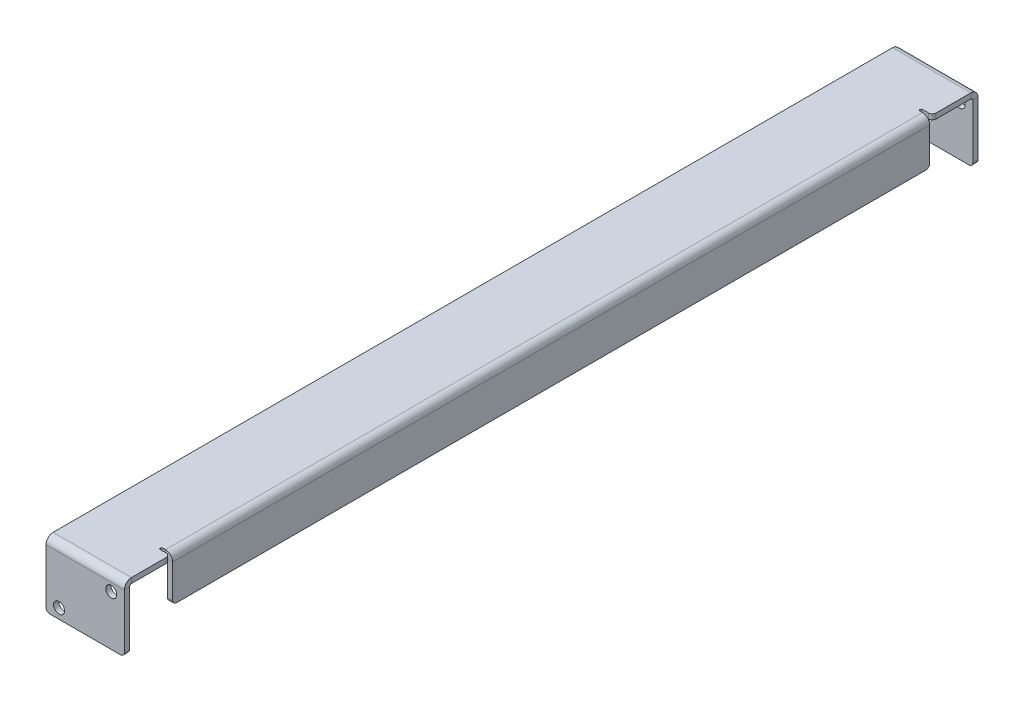
from build123d import *

# Parameters (mm, degrees)
SKETCH1_W                    = 327
SKETCH1_H                    = 2
BASE_FLANGE1_DEPTH           = 15
EDGE_FLANGE1_STRIP_W         = 9.4732
EDGE_FLANGE1_STRIP_H         = 2
EDGE_FLANGE1_STRIP_CUT_DEPTH = 30
EDGE_FLANGE1_DEPTH           = 30
CUT_EXTRUDE1_REACH           = 329.582
SKETCH9_R                    = 2.1
EDGE_FLANGE2_START           = 9.7634
EDGE_FLANGE2_DEPTH           = 3.2366
EDGE_FLANGE2_START_2         = -4.5
EDGE_FLANGE2_2_OUTLINE_W     = 2
EDGE_FLANGE2_2_OUTLINE_H     = 290
EDGE_FLANGE2_2_DEPTH         = 14.2634
EDGE_FLANGE2_START_3         = -145
EDGE_FLANGE2_3_DEPTH         = 290
EDGE_FLANGE2_4_DEPTH         = 290
FILLET1_R                    = 1.5


with BuildPart() as part:
    # Base-Flange1: sheet metal written as solids
    # Sketch1 → Base-Flange1 (new, symmetric)
    with BuildSketch(Plane(origin=(0, 0, 0), x_dir=(0, 0, -1), z_dir=(1, 0, 0))):
        with Locations((0, 11.5)):
            Rectangle(SKETCH1_W, SKETCH1_H)
    extrude(amount=BASE_FLANGE1_DEPTH, both=True)

    # Edge-Flange1: sheet metal written as solids
    # Edge-Flange1 strip (on a plane across the edge) → Edge-Flange1 strip cut (cut)
    with BuildSketch(Plane(origin=(15, 10.5, 163.5), x_dir=(0, 0, -1), z_dir=(-1, 0, 0))):
        with Locations((-2, -1)):
            Rectangle(EDGE_FLANGE1_STRIP_W, EDGE_FLANGE1_STRIP_H)
    edge_flange1_strip_cut = extrude(amount=EDGE_FLANGE1_STRIP_CUT_DEPTH, mode=Mode.SUBTRACT)

    # Edge-Flange1 section (on a plane across the edge) → Edge-Flange1 (add)
    with BuildSketch(Plane(origin=(15, 10.5, 163.5), x_dir=(0, 0, -1), z_dir=(-1, 0, 0))):
        with BuildLine():
            Line((0, 0.7366), (0, 23))
            Line((0, 23), (2, 23))
            Line((2, 23), (2, 0.7366))
            ThreePointArc((2, 0.7366), (2.215745145, 0.215745145), (2.7366, 0))
            Line((2.7366, 0), (2.7366, -2))
            ThreePointArc((2.7366, -2), (0.801531583, -1.198468417), (0, 0.7366))
        make_face()
    edge_flange1 = extrude(amount=EDGE_FLANGE1_DEPTH)

    # Mirror1: Edge-Flange1 strip cut, Edge-Flange1 across plane
    add(edge_flange1_strip_cut.mirror(Plane.XY), mode=Mode.SUBTRACT)
    add(edge_flange1.mirror(Plane.XY))

    # Sketch9 → Cut-Extrude1 (cut, up to next)
    with BuildSketch(Plane.XY.offset(163.5), mode=Mode.PRIVATE) as cut_extrude1_sk1:
        with Locations((10, 6.666666667)):
            Circle(SKETCH9_R)
    cut_extrude1_tool1 = extrude(cut_extrude1_sk1.sketch, amount=-CUT_EXTRUDE1_REACH, mode=Mode.PRIVATE) & part.part
    # Sketch9 → Cut-Extrude1 (cut, up to next)
    with BuildSketch(Plane.XY.offset(163.5), mode=Mode.PRIVATE) as cut_extrude1_sk2:
        with Locations((-10, -8.666666667)):
            Circle(SKETCH9_R)
    cut_extrude1_tool2 = extrude(cut_extrude1_sk2.sketch, amount=-CUT_EXTRUDE1_REACH, mode=Mode.PRIVATE) & part.part
    cut_extrude1_1 = cut_extrude1_tool1.solids().sort_by_distance((10, 6.666667, 163.5))[0]
    add(cut_extrude1_1, mode=Mode.SUBTRACT)
    cut_extrude1_2 = cut_extrude1_tool2.solids().sort_by_distance((-10, -8.666667, 163.5))[0]
    add(cut_extrude1_2, mode=Mode.SUBTRACT)
    cut_extrude1 = cut_extrude1_1 + cut_extrude1_2  # Cut-Extrude1 as one shape, for the pattern or mirror that repeats it

    # Mirror2: Cut-Extrude1 across plane
    add(cut_extrude1.mirror(Plane.XY), mode=Mode.SUBTRACT)

    # Edge-Flange2: read off the stored shape, not the designer's step
    # Edge-Flange2 outline → Edge-Flange2 (cut)
    with BuildSketch(Plane(origin=(0, 0, 0), x_dir=(1, 0, 0), z_dir=(0, 1, 0)).offset(EDGE_FLANGE2_START)):
        with BuildLine():
            Line((15, -146), (15, -145))
            Line((15, -145), (11.2634, -145))
            ThreePointArc((11.2634, -145), (10.7634, -145.5), (11.2634, -146))
            Line((11.2634, -146), (15, -146))
        make_face()
        with BuildLine():
            Line((11.2634, 145), (15, 145))
            Line((15, 145), (15, 146))
            Line((15, 146), (11.2634, 146))
            ThreePointArc((11.2634, 146), (10.7634, 145.5), (11.2634, 145))
        make_face()
    extrude(amount=EDGE_FLANGE2_DEPTH, mode=Mode.SUBTRACT)

    # Edge-Flange2 3 outline → Edge-Flange2 3 (cut)
    with BuildSketch(Plane.XY.offset(EDGE_FLANGE2_START_3)):
        with BuildLine():
            ThreePointArc((12.2634, 12.5), (13.917667209, 11.943395312), (14.899002398, 10.5))
            Line((14.899002398, 10.5), (15, 10.5))
            Line((15, 10.5), (15, 12.5))
            Line((15, 12.5), (12.2634, 12.5))
        make_face()
    extrude(amount=EDGE_FLANGE2_3_DEPTH, mode=Mode.SUBTRACT)



with BuildPart() as body_2:
    # Edge-Flange2 2 outline → Edge-Flange2 2 (new body)
    with BuildSketch(Plane(origin=(0, 0, 0), x_dir=(1, 0, 0), z_dir=(0, 1, 0)).offset(EDGE_FLANGE2_START_2)):
        with Locations((14, 0)):
            Rectangle(EDGE_FLANGE2_2_OUTLINE_W, EDGE_FLANGE2_2_OUTLINE_H)
    extrude(amount=EDGE_FLANGE2_2_DEPTH)


with BuildPart() as part_1:
    add(part.part)

    add(body_2.part)  # Edge-Flange2 4 merges body 2
    # Edge-Flange2 4 outline → Edge-Flange2 4 (add)
    with BuildSketch(Plane.XY.offset(EDGE_FLANGE2_START_3)):
        with BuildLine():
            Line((13, 9.7634), (15, 9.7634))
            ThreePointArc((15, 9.7634), (14.974633029, 10.135145906), (14.899002398, 10.5))
            Line((14.899002398, 10.5), (12.2634, 10.5))
            ThreePointArc((12.2634, 10.5), (12.784254855, 10.284254855), (13, 9.7634))
        make_face()
    extrude(amount=EDGE_FLANGE2_4_DEPTH)

    # Fillet1
    fillet1_edges = [part_1.edges().sort_by_distance(p)[0] for p in [
        (15, 11.5, 146),
        (15, 11.5, -146),
        (14, -4.5, -145),
        (14, -4.5, 145),
        (15, -12.5, 162.5),
        (-15, -12.5, 162.5),
        (-15, -12.5, -162.5),
        (15, -12.5, -162.5),
    ]]
    fillet(fillet1_edges, radius=FILLET1_R)


solid = part_1.part
